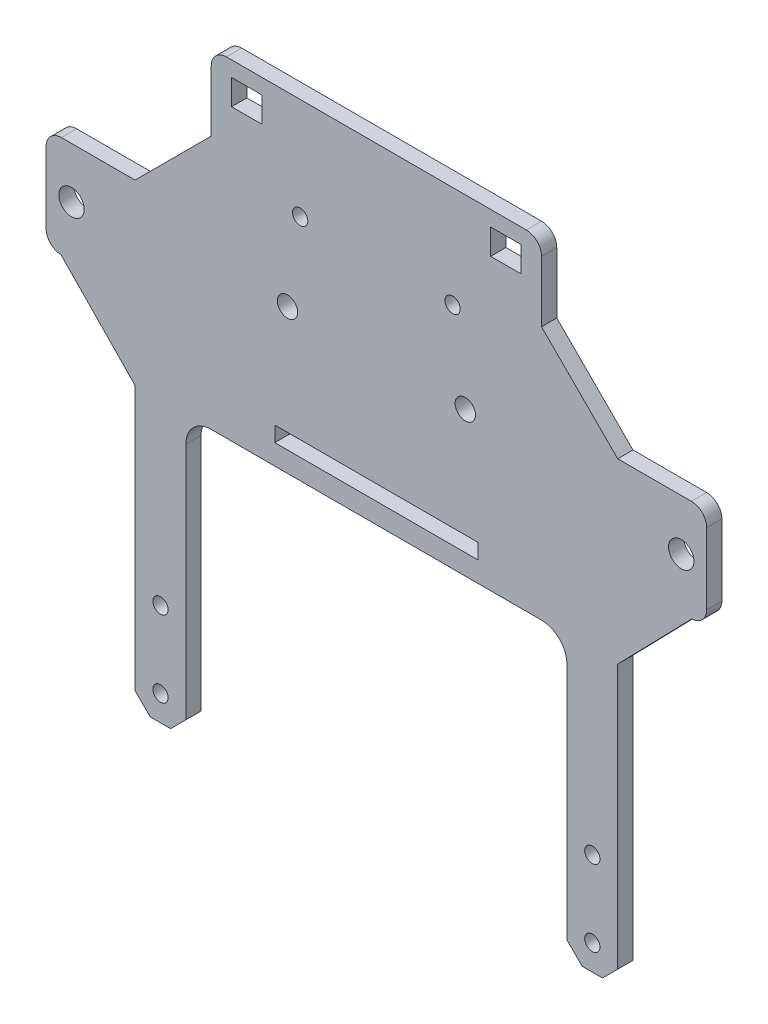
from build123d import *

# Parameters (mm, degrees)
SKETCH1_R           = 1.5
SKETCH1_R_2         = 2.5
BOSS_EXTRUDE1_DEPTH = 3
CUT_EXTRUDE1_DEPTH  = 3
FILLET1_R           = 3
CHAMFER4_SIZE       = 15
CHAMFER5_DEPTH      = 3
SKETCH8_R           = 2
CUT_EXTRUDE4_DEPTH  = 10
SKETCH10_W          = 65
SKETCH10_H          = 15
BOSS_EXTRUDE2_DEPTH = 3
SKETCH9_W           = 6
SKETCH9_H           = 5
CUT_EXTRUDE5_DEPTH  = 10
FILLET2_R           = 3
SKETCH11_W          = 40
SKETCH11_H          = 3
CUT_EXTRUDE6_DEPTH  = 10


with BuildPart() as part:
    # Sketch1 → Boss-Extrude1 (new body)
    with BuildSketch(Plane.XY):
        with BuildLine():
            Line((40.5, -40), (44.5, -40))
            Line((44.5, -40), (47.5, -37))
            Line((47.5, -37), (47.5, 10))
            Line((47.5, 10), (47.5, 15))
            Line((47.5, 15), (52.5, 15))
            Line((52.5, 15), (70, 15))
            ThreePointArc((70, 15), (73.535533906, 16.464466094), (75, 20))
            Line((75, 20), (75, 60))
            ThreePointArc((75, 60), (73.535533906, 63.535533906), (70, 65))
            Line((70, 65), (-70, 65))
            ThreePointArc((-70, 65), (-73.535533906, 63.535533906), (-75, 60))
            Line((-75, 60), (-75, 20))
            ThreePointArc((-75, 20), (-73.535533906, 16.464466094), (-70, 15))
            Line((-70, 15), (-52.5, 15))
            Line((-52.5, 15), (-47.5, 15))
            Line((-47.5, 15), (-47.5, 10))
            Line((-47.5, 10), (-47.5, -37))
            Line((-47.5, -37), (-44.5, -40))
            Line((-44.5, -40), (-40.5, -40))
            Line((-40.5, -40), (-37.5, -37))
            Line((-37.5, -37), (-37.5, 10))
            ThreePointArc((-37.5, 10), (-36.035533906, 13.535533906), (-32.5, 15))
            Line((-32.5, 15), (32.5, 15))
            ThreePointArc((32.5, 15), (36.035533906, 13.535533906), (37.5, 10))
            Line((37.5, 10), (37.5, -37))
            Line((37.5, -37), (40.5, -40))
        make_face()
        with Locations((-42.5, -20)):
            Circle(SKETCH1_R, mode=Mode.SUBTRACT)
        with Locations((-42.5, -35)):
            Circle(SKETCH1_R, mode=Mode.SUBTRACT)
        with Locations((42.5, -20)):
            Circle(SKETCH1_R, mode=Mode.SUBTRACT)
        with Locations((42.5, -35)):
            Circle(SKETCH1_R, mode=Mode.SUBTRACT)
        with Locations((60, 40)):
            Circle(SKETCH1_R_2, mode=Mode.SUBTRACT)
        with Locations((15, 60)):
            Circle(SKETCH1_R, mode=Mode.SUBTRACT)
        with Locations(Location((-15, 60, 0), (0, 0, 180))):
            Circle(SKETCH1_R, mode=Mode.SUBTRACT)
        with Locations(Location((-60, 40, 0), (0, 0, 180))):
            Circle(SKETCH1_R_2, mode=Mode.SUBTRACT)
    extrude(amount=BOSS_EXTRUDE1_DEPTH)

    # Sketch3 → Cut-Extrude1 (cut)
    with BuildSketch(Plane.XY.offset(3)):
        Polygon((65, 50), (65, 30), (47.5, 30), (47.5, 15), (75, 15), (75, 23.034767996), (75, 32.364095159), (75, 65), (47.5, 65), (47.5, 50), align=None)
        Polygon((-47.5, 65), (-75, 65), (-75, 32.364095159), (-75, 23.034767996), (-75, 15), (-47.5, 15), (-47.5, 30), (-65, 30), (-65, 50), (-47.5, 50), align=None)
    extrude(amount=-CUT_EXTRUDE1_DEPTH, mode=Mode.SUBTRACT)

    # Fillet1
    fillet1_edges = [part.edges().sort_by_distance(p)[0] for p in [
        (65, 50, 1.5),
        (65, 30, 1.5),
        (-65, 50, 1.5),
        (-65, 30, 1.5),
    ]]
    fillet(fillet1_edges, radius=FILLET1_R)

    # Chamfer4
    chamfer4_edges = [part.edges().sort_by_distance(p)[0] for p in [
        (47.5, 65, 1.5),
        (-47.5, 65, 1.5),
    ]]
    chamfer(chamfer4_edges, length=CHAMFER4_SIZE - 0.0001)  # a hair under: the kernel refuses the full size

    # Chamfer5: read off the stored shape, not the designer's step
    # Chamfer5 outline → Chamfer5 (add)
    with BuildSketch(Plane.XY):
        with BuildLine():
            Line((47.5, 15.006945785), (62.083333333, 30.001157631))
            ThreePointArc((62.083333333, 30.001157631), (62.041670687, 30.000289422), (62, 30))
            Line((62, 30), (47.5, 30))
            Line((47.5, 30), (47.5, 15.006945785))
        make_face()
        with BuildLine():
            Line((-62.083333333, 30.001157631), (-47.5, 15.006945785))
            Line((-47.5, 15.006945785), (-47.5, 30))
            Line((-47.5, 30), (-62, 30))
            ThreePointArc((-62, 30), (-62.041670687, 30.000289422), (-62.083333333, 30.001157631))
        make_face()
    extrude(amount=CHAMFER5_DEPTH)

    # Sketch8 → Cut-Extrude4 (cut)
    with BuildSketch(Plane.XY.offset(3)):
        with Locations((-17.5, 43.444515249)):
            Circle(SKETCH8_R)
        with Locations((17.5, 43.444515249)):
            Circle(SKETCH8_R)
    extrude(amount=-CUT_EXTRUDE4_DEPTH, mode=Mode.SUBTRACT)

    # Sketch10 → Boss-Extrude2 (add)
    with BuildSketch(Plane.XY.offset(3)):
        with Locations((0, 72.5)):
            Rectangle(SKETCH10_W, SKETCH10_H)
    extrude(amount=-BOSS_EXTRUDE2_DEPTH)

    # Sketch9 → Cut-Extrude5 (cut)
    with BuildSketch(Plane.XY.offset(3)):
        with Locations((-25.5, 74.5)):
            Rectangle(SKETCH9_W, SKETCH9_H)
        with Locations((25.5, 74.5)):
            Rectangle(SKETCH9_W, SKETCH9_H)
    extrude(amount=-CUT_EXTRUDE5_DEPTH, mode=Mode.SUBTRACT)

    # Fillet2
    fillet2_edges = [part.edges().sort_by_distance(p)[0] for p in [
        (-32.5, 80, 1.5),
        (32.5, 80, 1.5),
    ]]
    fillet(fillet2_edges, radius=FILLET2_R)

    # Sketch11 → Cut-Extrude6 (cut)
    with BuildSketch(Plane.XY.offset(3)):
        with Locations((0, 20.5)):
            Rectangle(SKETCH11_W, SKETCH11_H)
    extrude(amount=-CUT_EXTRUDE6_DEPTH, mode=Mode.SUBTRACT)


solid = part.part
